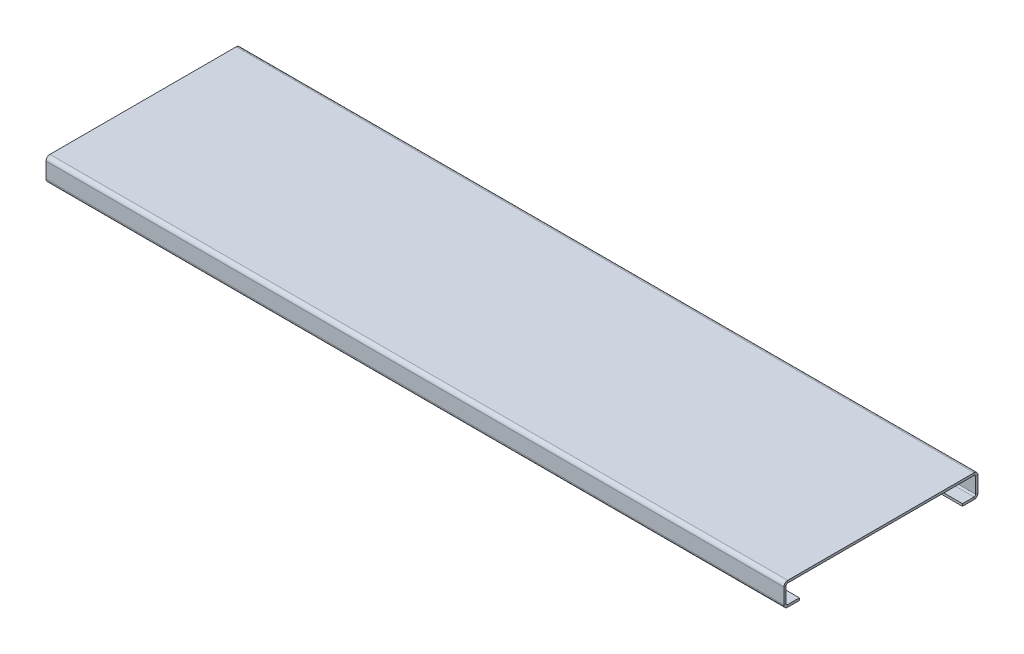
from build123d import *

# Parameters (mm, degrees)
BASE_FLANGIA1_DEPTH = 950


# Sheet-metal steps are written as plain solids
with BuildPart() as part:
    # Schizzo1 → Base-Flangia1 (new body)
    with BuildSketch(Plane(origin=(0, 0, 0), x_dir=(0, 0, -1), z_dir=(1, 0, 0))):
        with BuildLine():
            Line((230, -30), (245, -30))
            ThreePointArc((245, -30), (248.535533906, -28.535533906), (250, -25))
            Line((250, -25), (250, -5))
            ThreePointArc((250, -5), (248.535533906, -1.464466094), (245, 0))
            Line((245, 0), (5, 0))
            ThreePointArc((5, 0), (1.464466094, -1.464466094), (0, -5))
            Line((0, -5), (0, -25))
            ThreePointArc((0, -25), (1.464466094, -28.535533906), (5, -30))
            Line((5, -30), (20, -30))
            Line((20, -30), (20, -27))
            Line((20, -27), (5, -27))
            ThreePointArc((5, -27), (3.585786438, -26.414213562), (3, -25))
            Line((3, -25), (3, -5))
            ThreePointArc((3, -5), (3.585786438, -3.585786438), (5, -3))
            Line((5, -3), (245, -3))
            ThreePointArc((245, -3), (246.414213562, -3.585786438), (247, -5))
            Line((247, -5), (247, -25))
            ThreePointArc((247, -25), (246.414213562, -26.414213562), (245, -27))
            Line((245, -27), (230, -27))
            Line((230, -27), (230, -30))
        make_face()
    extrude(amount=BASE_FLANGIA1_DEPTH)


solid = part.part
